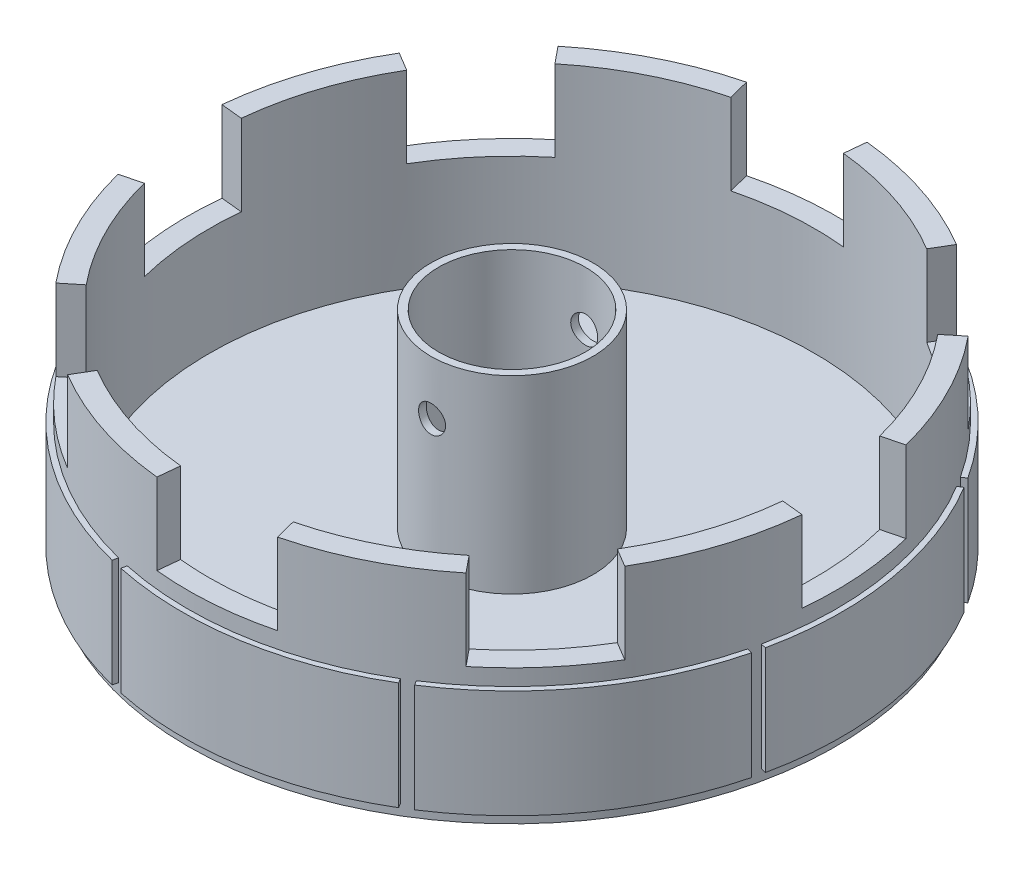
from build123d import *

# Parameters (mm, degrees)
SKETCH2_R           = 76.2
BOSS_EXTRUDE1_DEPTH = 50.8
SKETCH3_R           = 71.12
SKETCH3_R_2         = 19.05
CUT_EXTRUDE1_DEPTH  = 44.45
SKETCH4_R           = 17.272
CUT_EXTRUDE2_DEPTH  = 120.1365603
CUT_EXTRUDE3_DEPTH  = 19.05
CIRPATTERN1_COUNT   = 8
SKETCH6_R           = 3.175
CUT_EXTRUDE4_DEPTH  = 25.4
WRAP1_START         = 2.54
WRAP1_DEPTH         = 25.4
CIRPATTERN2_COUNT   = 8


# Read off the part's stored shape, not the designer's step: Wrap1
with BuildPart() as part:
    # Sketch2 → Boss-Extrude1 (new body)
    with BuildSketch(Plane(origin=(0, 0, 0), x_dir=(1, 0, 0), z_dir=(0, 1, 0))):
        with Locations(Location((0, 0, 0), (0, 0, 270))):
            Circle(SKETCH2_R)
    extrude(amount=BOSS_EXTRUDE1_DEPTH)

    # Sketch3 → Cut-Extrude1 (cut)
    with BuildSketch(Plane(origin=(0, 50.8, 0), x_dir=(1, 0, 0), z_dir=(0, 1, 0))):
        with Locations(Location((0, 0, 0), (0, 0, 270))):
            Circle(SKETCH3_R)
        with Locations(Location((0, 0, 0), (0, 0, 270))):
            Circle(SKETCH3_R_2, mode=Mode.SUBTRACT)
    extrude(amount=-CUT_EXTRUDE1_DEPTH, mode=Mode.SUBTRACT)

    # Sketch4 → Cut-Extrude2 (cut, through all)
    with BuildSketch(Plane(origin=(0, 50.8, 0), x_dir=(1, 0, 0), z_dir=(0, 1, 0))):
        with Locations(Location((0, 0, 0), (0, 0, 270))):
            Circle(SKETCH4_R)
    extrude(amount=-CUT_EXTRUDE2_DEPTH, mode=Mode.SUBTRACT)

    # Sketch5 → Cut-Extrude3 (cut)
    with BuildSketch(Plane(origin=(0, 50.8, 0), x_dir=(1, 0, 0), z_dir=(0, 1, 0))):
        with BuildLine():
            Line((-44.991655358, 55.079990451), (-48.205345027, 59.014275484))
            ThreePointArc((-48.205345027, 59.014275484), (-57.719695429, 49.748133227), (-65.480674483, 38.970774553))
            Line((-65.480674483, 38.970774553), (-61.115296184, 36.372722916))
            ThreePointArc((-61.115296184, 36.372722916), (-53.871715734, 46.431591012), (-44.991655358, 55.079990451))
        make_face()
    cut_extrude3 = extrude(amount=-CUT_EXTRUDE3_DEPTH, mode=Mode.SUBTRACT)

    # CirPattern1: Cut-Extrude3 ×8 about axis
    cirpattern1_axis = Axis((0, 0, 0), (0, 1, 0))
    for i in range(1, CIRPATTERN1_COUNT):
        add(cut_extrude3.rotate(cirpattern1_axis, i * 360 / CIRPATTERN1_COUNT), mode=Mode.SUBTRACT)

    # Sketch6 → Cut-Extrude4 (cut, symmetric)
    with BuildSketch(Plane.XY):
        with Locations((0, 38.1)):
            Circle(SKETCH6_R)
    extrude(amount=CUT_EXTRUDE4_DEPTH, both=True, mode=Mode.SUBTRACT)

    # Wrap1 outline → Wrap1 (add)
    with BuildSketch(Plane(origin=(0, 0, 0), x_dir=(1, 0, 0), z_dir=(0, 1, 0)).offset(WRAP1_START)):
        with BuildLine():
            ThreePointArc((75.761080539, -16.182075751), (76.423312697, 12.691657751), (66.463869373, 39.801444294))
            Line((66.463869373, 39.801444294), (65.374297744, 39.148961601))
            ThreePointArc((65.374297744, 39.148961601), (75.170471505, 12.483597787), (74.519095612, -15.916795821))
            Line((74.519095612, -15.916795821), (75.761080539, -16.182075751))
        make_face()
    wrap1 = extrude(amount=WRAP1_DEPTH)

    # CirPattern2: Wrap1 ×8 about axis
    cirpattern2_axis = Axis((0, 0, 0), (0, 1, 0))
    for i in range(1, CIRPATTERN2_COUNT):
        add(wrap1.rotate(cirpattern2_axis, i * 360 / CIRPATTERN2_COUNT))


solid = part.part
